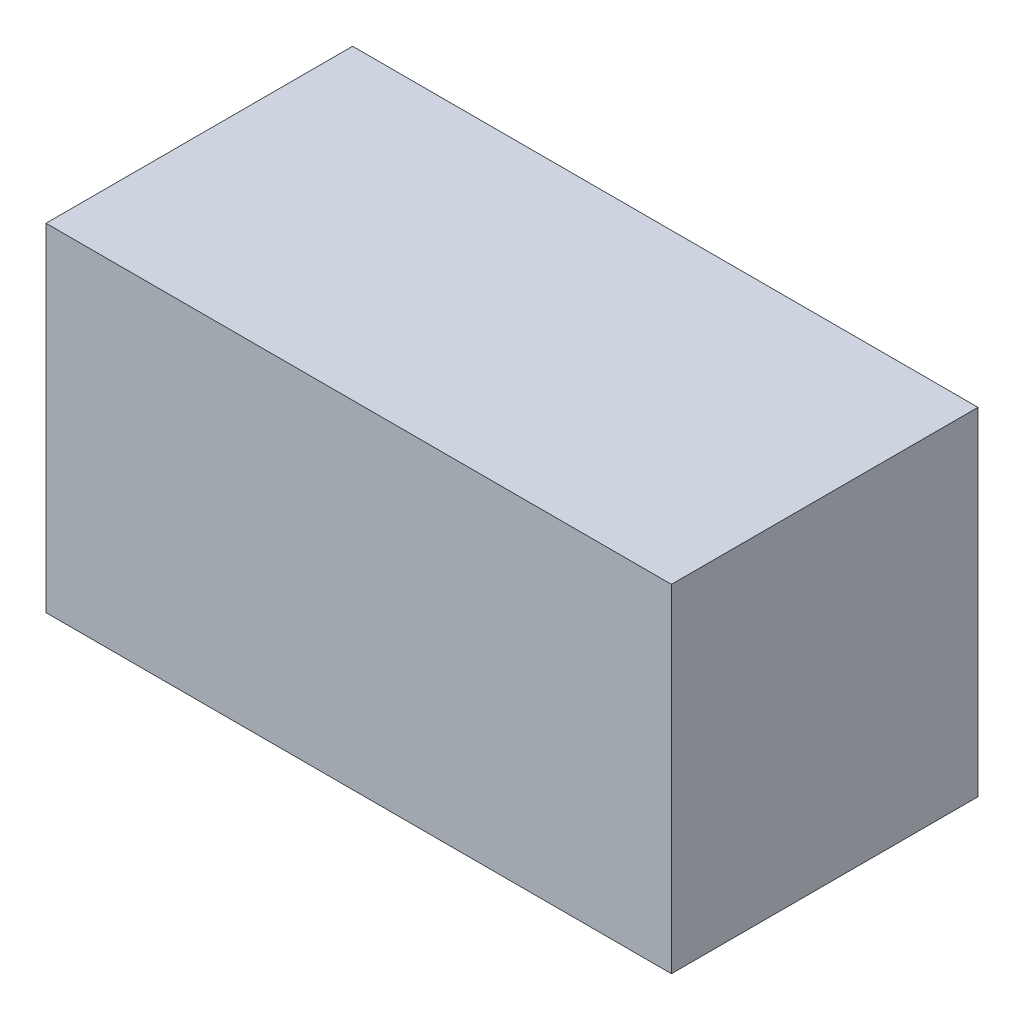
from build123d import *

# Parameters (mm, degrees)
SKETCH_1_W          = 10.2
SKETCH_1_H          = 5
EXTRUDE_1_DEPTH     = 5.5
SKETCH_7_R          = 1.5
CUT_EXTRUDE_6_DEPTH = 2
SKETCH_6_R          = 1.5
CUT_EXTRUDE_7_DEPTH = 3.2
SKETCH_3_R          = 1.5
CUT_EXTRUDE_9_DEPTH = 4.8


with BuildPart() as part:
    # 草图1 → 凸台-拉伸1 (new body)
    with BuildSketch(Plane(origin=(0, 0, 0), x_dir=(1, 0, 0), z_dir=(0, 1, 0))):
        with Locations((5.1, 2.5)):
            Rectangle(SKETCH_1_W, SKETCH_1_H)
    extrude(amount=EXTRUDE_1_DEPTH)

    # 草图7 → 切除-拉伸6 (cut)
    with BuildSketch(Plane(origin=(0, 0, 0), x_dir=(1, 0, 0), z_dir=(0, 1, 0))):
        with Locations((2, 2.5)):
            Circle(SKETCH_7_R)
    extrude(amount=CUT_EXTRUDE_6_DEPTH, mode=Mode.SUBTRACT)

    # 草图6 → 切除-拉伸7 (cut)
    with BuildSketch(Plane(origin=(0, 0, 0), x_dir=(1, 0, 0), z_dir=(0, 1, 0))):
        with Locations((5.1, 2.5)):
            Circle(SKETCH_6_R)
    extrude(amount=CUT_EXTRUDE_7_DEPTH, mode=Mode.SUBTRACT)

    # 草图3 → 切除-拉伸9 (cut)
    with BuildSketch(Plane(origin=(0, 0, 0), x_dir=(1, 0, 0), z_dir=(0, 1, 0))):
        with Locations((8.2, 2.5)):
            Circle(SKETCH_3_R)
    extrude(amount=CUT_EXTRUDE_9_DEPTH, mode=Mode.SUBTRACT)


solid = part.part
